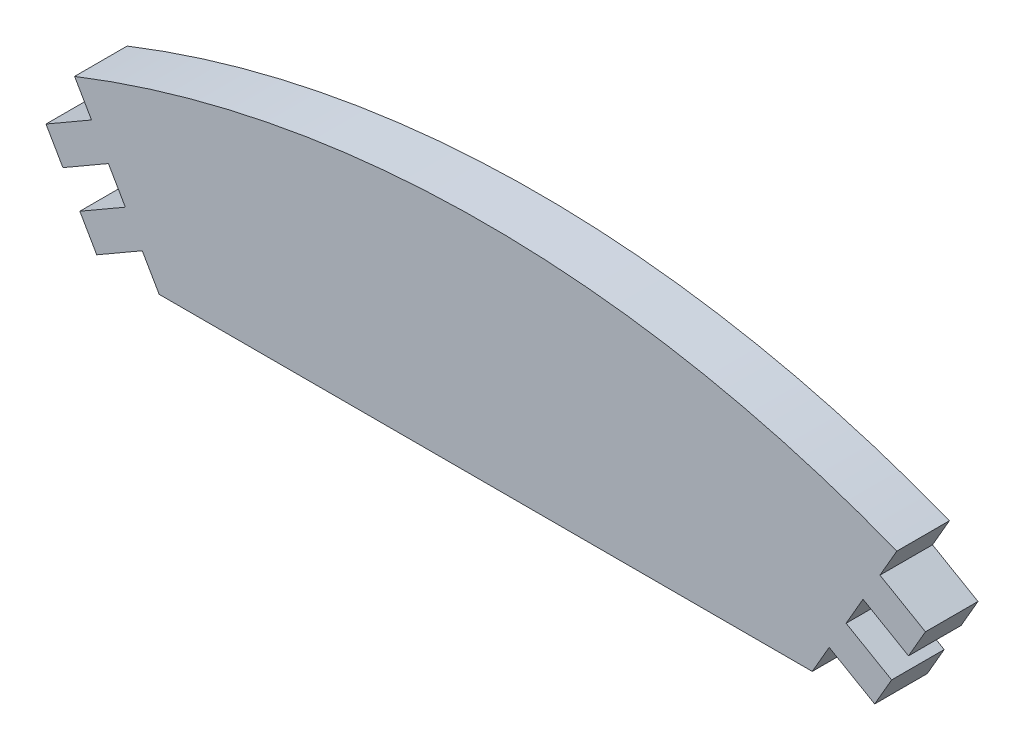
from build123d import *

# Parameters (mm, degrees)
BOSS_EXTRUDE1_DEPTH = 5.15


with BuildPart() as part:
    # Sketch1 → Boss-Extrude1 (new body)
    with BuildSketch(Plane.XY):
        with BuildLine():
            Line((-32, 88), (32, 88))
            Line((32, 88), (33.657729839, 90.871272306))
            Line((33.657729839, 90.871272306), (38.117760668, 88.296272306))
            Line((38.117760668, 88.296272306), (39.775490507, 91.167544613))
            Line((39.775490507, 91.167544613), (35.315459678, 93.742544613))
            Line((35.315459678, 93.742544613), (36.973189517, 96.613816919))
            Line((36.973189517, 96.613816919), (41.433220346, 94.038816919))
            Line((41.433220346, 94.038816919), (43.090950185, 96.910089225))
            Line((43.090950185, 96.910089225), (38.630919356, 99.485089225))
            Line((38.630919356, 99.485089225), (40.288649195, 102.356361532))
            ThreePointArc((40.288649195, 102.356361532), (0, 110), (-40.288649195, 102.356361532))
            Line((-40.288649195, 102.356361532), (-38.630919356, 99.485089225))
            Line((-38.630919356, 99.485089225), (-43.090950185, 96.910089225))
            Line((-43.090950185, 96.910089225), (-41.433220346, 94.038816919))
            Line((-41.433220346, 94.038816919), (-36.973189517, 96.613816919))
            Line((-36.973189517, 96.613816919), (-35.315459678, 93.742544613))
            Line((-35.315459678, 93.742544613), (-39.775490507, 91.167544613))
            Line((-39.775490507, 91.167544613), (-38.117760668, 88.296272306))
            Line((-38.117760668, 88.296272306), (-33.657729839, 90.871272306))
            Line((-33.657729839, 90.871272306), (-32, 88))
        make_face()
    extrude(amount=BOSS_EXTRUDE1_DEPTH)


solid = part.part
